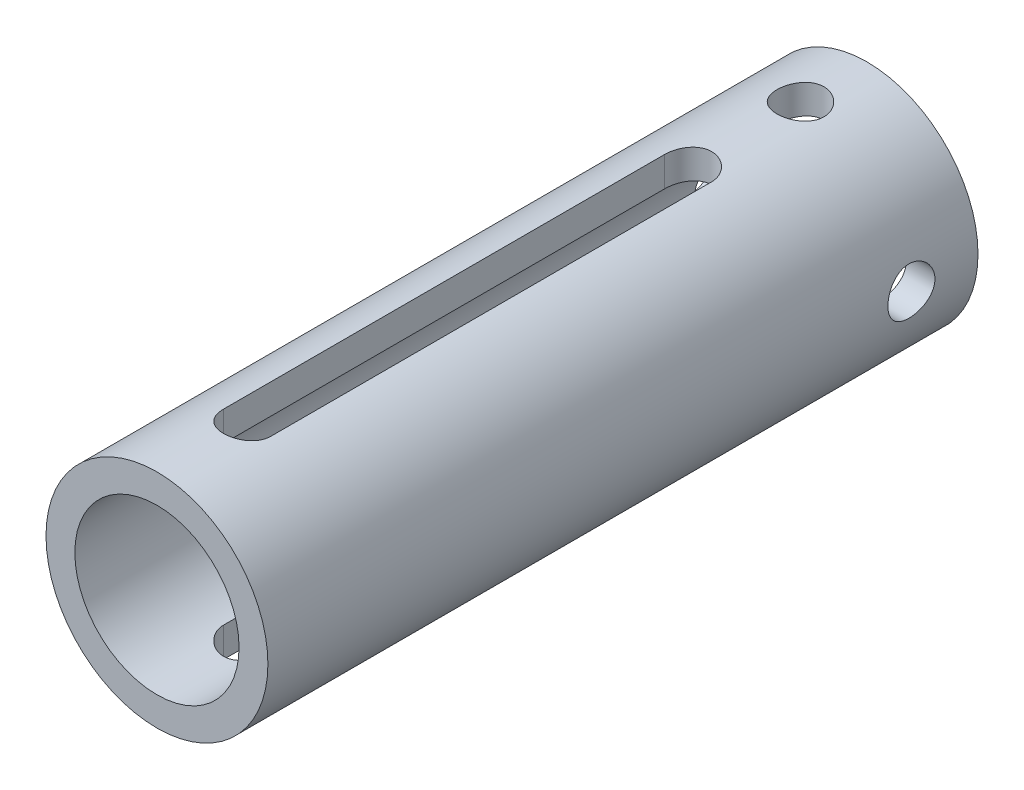
from build123d import *

# Parameters (mm, degrees)
SKETCH1_R                   = 15.875
SKETCH1_R_2                 = 11.7475
BOSS_EXTRUDE1_DEPTH         = 101.6
F_1_4_START                 = 10
F_1_4_CLEARANCE_SLOT1_DEPTH = 7
CUT_EXTRUDE1_REACH          = 106.051
CUT_EXTRUDE1_END_RADIUS     = 15.875
CUT_EXTRUDE2_DEPTH          = 105.050907141
CUT_EXTRUDE2_DEPTH_BACK     = 105.050907141
SKETCH5_R                   = 3.3655
CUT_EXTRUDE3_DEPTH          = 105.050907141
CUT_EXTRUDE3_DEPTH_BACK     = 105.050907141
SKETCH6_R                   = 3.3655


with BuildPart() as part:
    # Sketch1 → Boss-Extrude1 (new body)
    with BuildSketch(Plane.XY):
        Circle(SKETCH1_R)
        Circle(SKETCH1_R_2, mode=Mode.SUBTRACT)
    extrude(amount=BOSS_EXTRUDE1_DEPTH)

    # 1/4 Clearance Slot1: read off the stored shape, not the designer's step
    # 1/4 Clearance Slot1 outline → 1/4 Clearance Slot1 (cut)
    with BuildSketch(Plane(origin=(0, 0, 0), x_dir=(1, 0, 0), z_dir=(0, 1, 0)).offset(F_1_4_START)):
        with BuildLine():
            Line((3.3782, -88.6968), (3.3782, -25.6032))
            ThreePointArc((3.3782, -25.6032), (0, -22.225), (-3.3782, -25.6032))
            Line((-3.3782, -25.6032), (-3.3782, -88.6968))
            ThreePointArc((-3.3782, -88.6968), (0, -92.075), (3.3782, -88.6968))
        make_face()
    extrude(amount=F_1_4_CLEARANCE_SLOT1_DEPTH, mode=Mode.SUBTRACT)

    # Cut-Extrude1: up to this cylinder (the profile starts inside it)
    cut_extrude1_end = Plane(origin=(0, 0, 57.15), z_dir=(0, 0, -1)) * Cylinder(CUT_EXTRUDE1_END_RADIUS, 244.852, mode=Mode.PRIVATE)
    # Sketch4 → Cut-Extrude1 (cut, up to the surface)
    with BuildSketch(Plane(origin=(0, 0, 0), x_dir=(1, 0, 0), z_dir=(0, 1, 0)), mode=Mode.PRIVATE) as cut_extrude1_sk1:
        with BuildLine():
            Line((-3.3782, -88.6968), (-3.3782, -25.6032))
            ThreePointArc((-3.3782, -25.6032), (0, -22.225), (3.3782, -25.6032))
            Line((3.3782, -25.6032), (3.3782, -88.6968))
            ThreePointArc((3.3782, -88.6968), (0, -92.075), (-3.3782, -88.6968))
        make_face()
    cut_extrude1_tool1 = extrude(cut_extrude1_sk1.sketch, amount=-CUT_EXTRUDE1_REACH, mode=Mode.PRIVATE) & cut_extrude1_end
    add(cut_extrude1_tool1.solids().sort_by_distance((0, 0, 57.15))[0], mode=Mode.SUBTRACT)

    # Sketch5 → Cut-Extrude2 (cut, two sides: drawn at the far end of the back side and taken through both)
    with BuildSketch(Plane(origin=(0, 0, 0), x_dir=(1, 0, 0), z_dir=(0, 1, 0)).offset(-CUT_EXTRUDE2_DEPTH_BACK)):
        with Locations(Location((0, -9.525, 0), (0, 0, 270))):
            Circle(SKETCH5_R)
    extrude(amount=CUT_EXTRUDE2_DEPTH + CUT_EXTRUDE2_DEPTH_BACK, mode=Mode.SUBTRACT)

    # Sketch6 → Cut-Extrude3 (cut, two sides: drawn at the far end of the back side and taken through both)
    with BuildSketch(Plane(origin=(0, 0, 0), x_dir=(0, 0, -1), z_dir=(1, 0, 0)).offset(-CUT_EXTRUDE3_DEPTH_BACK)):
        with Locations((-9.525, 0)):
            Circle(SKETCH6_R)
    extrude(amount=CUT_EXTRUDE3_DEPTH + CUT_EXTRUDE3_DEPTH_BACK, mode=Mode.SUBTRACT)


solid = part.part
